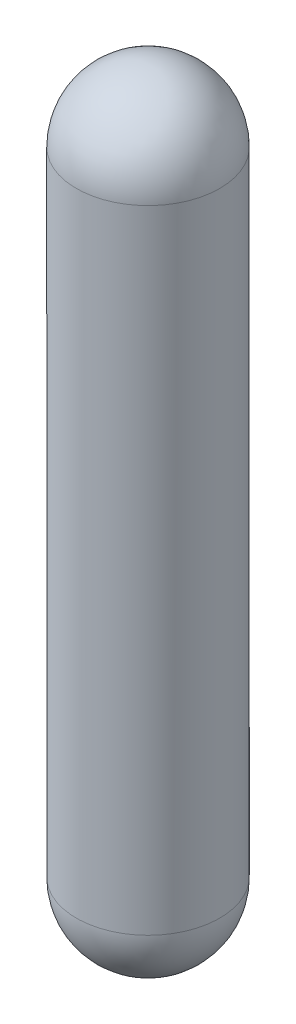
from build123d import *


with BuildPart() as part:
    # Sketch1 → Revolve1 (revolve)
    with BuildSketch(Plane.XY):
        with BuildLine():
            Line((0, 1477.5), (0, 1645))
            ThreePointArc((0, 1645), (118.440385849, 1595.940385849), (167.5, 1477.5))
            Line((167.5, 1477.5), (167.5, 0))
            ThreePointArc((167.5, 0), (118.440385849, -118.440385849), (0, -167.5))
            Line((0, -167.5), (0, 0))
            Line((0, 0), (0, 1477.5))
        make_face()
    revolve(axis=Axis((0, 0, 0), (0, 1, 0)))


solid = part.part
